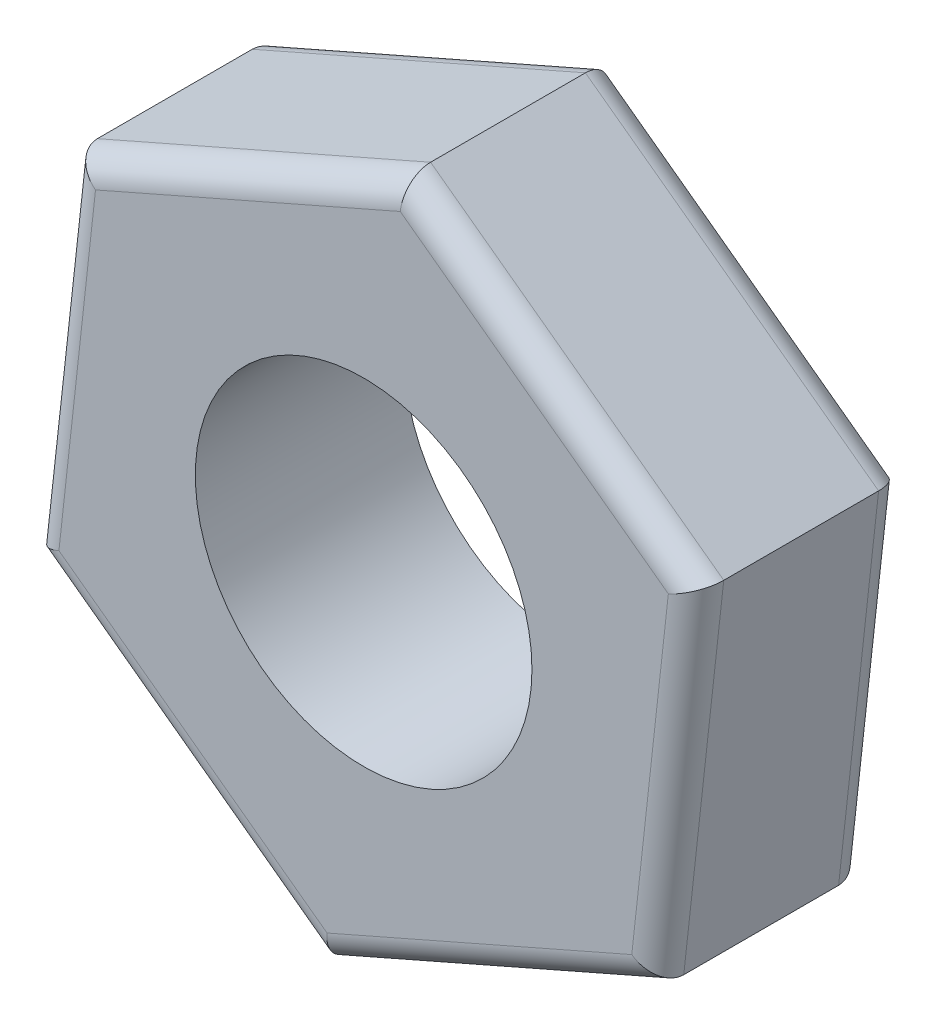
from build123d import *

# Parameters (mm, degrees)
BOSS_EXTRUDE1_DEPTH   = 1.55
FILLET1_R             = 0.2
F_2_5MM_DOWEL_HOLE1_D = 2.5


with BuildPart() as part:
    # Sketch1 → Boss-Extrude1 (new body)
    with BuildSketch(Plane.XY):
        Polygon((0.297131561, 2.68561219), (-2.177242601, 1.600129575), (-2.474374162, -1.085482615), (-0.297131561, -2.68561219), (2.177242601, -1.600129575), (2.474374162, 1.085482615), align=None)
    extrude(amount=BOSS_EXTRUDE1_DEPTH)

    # Fillet1
    fillet1_edges = [part.edges().sort_by_distance(p)[0] for p in [
        (-2.325808381, 0.25732348, 0),
        (0.94005552, -2.142870883, 0),
        (2.325808381, -0.25732348, 0),
        (1.385752862, 1.885547402, 0),
        (-0.94005552, 2.142870883, 0),
        (-1.385752862, -1.885547402, 0),
        (-1.385752862, -1.885547402, 1.55),
        (-2.325808381, 0.25732348, 1.55),
        (0.94005552, -2.142870883, 1.55),
        (2.325808381, -0.25732348, 1.55),
        (1.385752862, 1.885547402, 1.55),
        (-0.94005552, 2.142870883, 1.55),
    ]]
    fillet(fillet1_edges, radius=FILLET1_R)

    # Ø2.5mm Dowel Hole1 (through all)
    with Locations(Plane.XY.offset(1.55)):
        with Locations((0, 0)):
            Hole(F_2_5MM_DOWEL_HOLE1_D / 2)


solid = part.part
